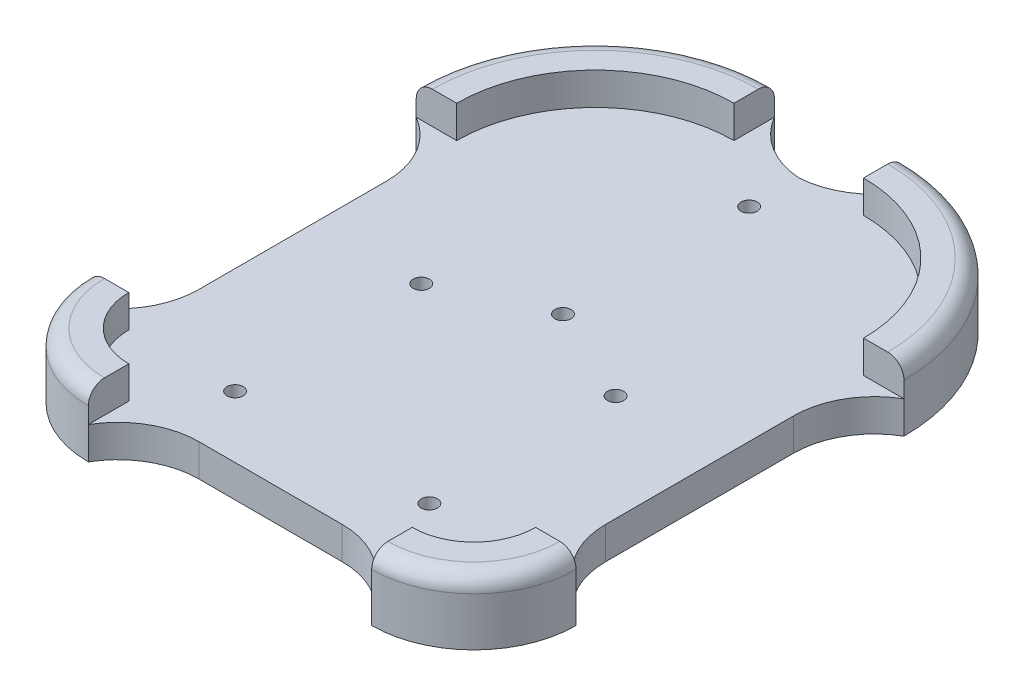
from build123d import *

# Parameters (mm, degrees)
SALIENTE_EXTRUIR1_DEPTH = 4
SALIENTE_EXTRUIR2_START = 4
SALIENTE_EXTRUIR2_DEPTH = 4
REDONDEO1_R             = 10
REDONDEO3_R             = 2
CROQUIS3_R              = 1
CROQUIS3_R_2            = 9
CORTAR_EXTRUIR1_DEPTH   = 2
CROQUIS3_3_R            = 1
CORTAR_EXTRUIR2_DEPTH   = 77.740023923


with BuildPart() as part:
    # Croquis1 → Saliente-Extruir1 (new body)
    with BuildSketch(Plane(origin=(0, 0, 0), x_dir=(1, 0, 0), z_dir=(0, 1, 0))):
        with BuildLine():
            Line((30.125, 7.5), (25.125, 7.5))
            Line((25.125, 7.5), (25.125, 48))
            Line((25.125, 48), (30.125, 48))
            ThreePointArc((30.125, 48), (23.644737534, 63.644737534), (8, 70.125))
            Line((8, 70.125), (8, 65.125))
            Line((8, 65.125), (-8, 65.125))
            Line((-8, 65.125), (-8, 70.125))
            ThreePointArc((-8, 70.125), (-23.644737534, 63.644737534), (-30.125, 48))
            Line((-30.125, 48), (-25.125, 48))
            Line((-25.125, 48), (-25.125, 7.5))
            Line((-25.125, 7.5), (-30.125, 7.5))
            ThreePointArc((-30.125, 7.5), (-26.427223112, -1.427223112), (-17.5, -5.125))
            Line((-17.5, -5.125), (-17.5, -0.125))
            Line((-17.5, -0.125), (17.5, -0.125))
            Line((17.5, -0.125), (17.5, -5.125))
            ThreePointArc((17.5, -5.125), (26.427223112, -1.427223112), (30.125, 7.5))
        make_face()
    extrude(amount=SALIENTE_EXTRUIR1_DEPTH)

    # Croquis1<3> → Saliente-Extruir2 (add)
    with BuildSketch(Plane(origin=(0, 0, 0), x_dir=(1, 0, 0), z_dir=(0, 1, 0)).offset(SALIENTE_EXTRUIR2_START)):
        with BuildLine():
            Line((-30.125, 48), (-25.125, 48))
            ThreePointArc((-25.125, 48), (-20.109203628, 60.109203628), (-8, 65.125))
            Line((-8, 65.125), (-8, 70.125))
            ThreePointArc((-8, 70.125), (-23.644737534, 63.644737534), (-30.125, 48))
        make_face()
        with BuildLine():
            Line((-17.5, -5.125), (-17.5, -0.125))
            ThreePointArc((-17.5, -0.125), (-22.891689207, 2.108310793), (-25.125, 7.5))
            Line((-25.125, 7.5), (-30.125, 7.5))
            ThreePointArc((-30.125, 7.5), (-26.427223112, -1.427223112), (-17.5, -5.125))
        make_face()
        with BuildLine():
            ThreePointArc((25.125, 7.5), (22.891689207, 2.108310793), (17.5, -0.125))
            Line((17.5, -0.125), (17.5, -5.125))
            ThreePointArc((17.5, -5.125), (26.427223112, -1.427223112), (30.125, 7.5))
            Line((30.125, 7.5), (25.125, 7.5))
        make_face()
        with BuildLine():
            ThreePointArc((8, 65.125), (20.109203628, 60.109203628), (25.125, 48))
            Line((25.125, 48), (30.125, 48))
            ThreePointArc((30.125, 48), (23.644737534, 63.644737534), (8, 70.125))
            Line((8, 70.125), (8, 65.125))
        make_face()
    extrude(amount=SALIENTE_EXTRUIR2_DEPTH)

    # Redondeo1
    # the kernel refuses this fillet: 10 mm, written as the material it adds along each edge
    with BuildSketch(Plane(origin=(8, 0, -65.125), x_dir=(-1, 0, 0), z_dir=(0, 1, 0)), Plane(origin=(-17.5, 0, 0.125), x_dir=(1, 0, 0), z_dir=(0, 1, 0)), Plane(origin=(-25.125, 0, -48), x_dir=(0, 0, 1), z_dir=(0, 1, 0))) as redondeo1_piece_1:
        with BuildLine():
            CenterArc((8.660254038, -10), REDONDEO1_R, 90, 60)
            Line((0, -5), (-0.173205081, -4.9))
            ThreePointArc((-0.173205081, -4.9), (-0.2, -2.5), (-0.2, 0))
            Line((-0.2, 0), (0, 0.2))
            Line((0, 0.2), (8.660254038, 0.2))
            Line((8.660254038, 0.2), (8.660254038, 0))
        make_face()
    extrude(amount=4)
    with BuildSketch(Plane(origin=(-8, 0, -65.125), x_dir=(0, 0, -1), z_dir=(0, 1, 0)), Plane(origin=(17.5, 0, 0.125), x_dir=(0, 0, 1), z_dir=(0, 1, 0)), Plane(origin=(25.125, 0, -48), x_dir=(1, 0, 0), z_dir=(0, 1, 0)), Plane(origin=(-25.125, 0, -7.5), x_dir=(-1, 0, 0), z_dir=(0, 1, 0))) as redondeo1_piece_2:
        with BuildLine():
            CenterArc((10, -8.660254038), REDONDEO1_R, 120, 60)
            Line((0, -8.660254038), (-0.2, -8.660254038))
            Line((-0.2, -8.660254038), (-0.2, 0))
            Line((-0.2, 0), (0, 0.2))
            ThreePointArc((0, 0.2), (2.5, 0.2), (4.9, 0.173205081))
            Line((4.9, 0.173205081), (5, 0))
        make_face()
    extrude(amount=4)
    with BuildSketch(Plane(origin=(25.125, 0, -7.5), x_dir=(1, 0, 0), z_dir=(0, 1, 0))) as redondeo1_piece_3:
        with BuildLine():
            CenterArc((10, 8.660254038), REDONDEO1_R, 180, 60)
            Line((0, 8.660254038), (-0.2, 8.660254038))
            Line((-0.2, 8.660254038), (-0.2, 0))
            Line((-0.2, 0), (0, -0.2))
            ThreePointArc((0, -0.2), (2.5, -0.2), (4.9, -0.173205081))
            Line((4.9, -0.173205081), (5, 0))
        make_face()
    extrude(amount=4)

    # Redondeo3
    redondeo3_edges = [part.edges().sort_by_distance(p)[0] for p in [
        (-23.644737534, 8, -63.644737534),
        (-26.427223112, 8, 1.427223112),
        (26.427223112, 8, 1.427223112),
        (23.644737534, 8, -63.644737534),
    ]]
    fillet(redondeo3_edges, radius=REDONDEO3_R)

    # Croquis3 → Cortar-Extruir1 (cut)
    # profile 1 of 5: a face of its own
    with BuildSketch(Plane(origin=(0, 0, 0), x_dir=(1, 0, 0), z_dir=(0, 1, 0))):
        with BuildLine():
            ThreePointArc((-9.5, 10.354191767), (-3, 19), (-9.5, 27.645808233))
            Line((-9.5, 27.645808233), (-9.5, 31.845808233))
            ThreePointArc((-9.5, 31.845808233), (-10.144365081, 33.401443152), (-11.7, 34.045808233))
            Line((-11.7, 34.045808233), (-12.3, 34.045808233))
            ThreePointArc((-12.3, 34.045808233), (-13.855634919, 33.401443152), (-14.5, 31.845808233))
            Line((-14.5, 31.845808233), (-14.5, 27.645808233))
            ThreePointArc((-14.5, 27.645808233), (-21, 19), (-14.5, 10.354191767))
            Line((-14.5, 10.354191767), (-14.5, 6.154191767))
            ThreePointArc((-14.5, 6.154191767), (-13.855634919, 4.598556848), (-12.3, 3.954191767))
            Line((-12.3, 3.954191767), (-11.7, 3.954191767))
            ThreePointArc((-11.7, 3.954191767), (-10.144365081, 4.598556848), (-9.5, 6.154191767))
            Line((-9.5, 6.154191767), (-9.5, 10.354191767))
        make_face()
        with Locations(Location((-12, 7.5, 0), (0, 0, 90))):
            Circle(CROQUIS3_R, mode=Mode.SUBTRACT)
        with Locations(Location((-12, 30.5, 0), (0, 0, 90))):
            Circle(CROQUIS3_R, mode=Mode.SUBTRACT)
    # profile 2 of 5: a face of its own
    with BuildSketch(Plane(origin=(0, 0, 0), x_dir=(1, 0, 0), z_dir=(0, 1, 0))):
        with BuildLine():
            Line((14.5, 27.645808233), (14.5, 31.845808233))
            ThreePointArc((14.5, 31.845808233), (13.855634919, 33.401443152), (12.3, 34.045808233))
            Line((12.3, 34.045808233), (11.7, 34.045808233))
            ThreePointArc((11.7, 34.045808233), (10.144365081, 33.401443152), (9.5, 31.845808233))
            Line((9.5, 31.845808233), (9.5, 27.645808233))
            ThreePointArc((9.5, 27.645808233), (3, 19), (9.5, 10.354191767))
            Line((9.5, 10.354191767), (9.5, 6.154191767))
            ThreePointArc((9.5, 6.154191767), (10.144365081, 4.598556848), (11.7, 3.954191767))
            Line((11.7, 3.954191767), (12.3, 3.954191767))
            ThreePointArc((12.3, 3.954191767), (13.855634919, 4.598556848), (14.5, 6.154191767))
            Line((14.5, 6.154191767), (14.5, 10.354191767))
            ThreePointArc((14.5, 10.354191767), (21, 19), (14.5, 27.645808233))
        make_face()
        with Locations(Location((12, 7.5, 0), (0, 0, 90))):
            Circle(CROQUIS3_R, mode=Mode.SUBTRACT)
        with Locations(Location((12, 30.5, 0), (0, 0, 90))):
            Circle(CROQUIS3_R, mode=Mode.SUBTRACT)
    # profile 3 of 5: a face of its own
    with BuildSketch(Plane(origin=(0, 0, 0), x_dir=(1, 0, 0), z_dir=(0, 1, 0))):
        with Locations((0, 47.5)):
            Circle(CROQUIS3_R_2)
    # profile 4 of 5: a face of its own
    with BuildSketch(Plane(origin=(0, 0, 0), x_dir=(1, 0, 0), z_dir=(0, 1, 0))):
        with BuildLine():
            Line((2.5, 34.654191767), (2.5, 38.854191767))
            ThreePointArc((2.5, 38.854191767), (0, 38.5), (-2.5, 38.854191767))
            Line((-2.5, 38.854191767), (-2.5, 34.654191767))
            ThreePointArc((-2.5, 34.654191767), (-1.855634919, 33.098556848), (-0.3, 32.454191767))
            Line((-0.3, 32.454191767), (0.3, 32.454191767))
            ThreePointArc((0.3, 32.454191767), (1.855634919, 33.098556848), (2.5, 34.654191767))
        make_face()
        with Locations(Location((0, 36, 0), (0, 0, 90))):
            Circle(CROQUIS3_R, mode=Mode.SUBTRACT)
    # profile 5 of 5: a face of its own
    with BuildSketch(Plane(origin=(0, 0, 0), x_dir=(1, 0, 0), z_dir=(0, 1, 0))):
        with BuildLine():
            ThreePointArc((-2.5, 56.145808233), (0, 56.5), (2.5, 56.145808233))
            Line((2.5, 56.145808233), (2.5, 60.345808233))
            ThreePointArc((2.5, 60.345808233), (1.855634919, 61.901443152), (0.3, 62.545808233))
            Line((0.3, 62.545808233), (-0.3, 62.545808233))
            ThreePointArc((-0.3, 62.545808233), (-1.855634919, 61.901443152), (-2.5, 60.345808233))
            Line((-2.5, 60.345808233), (-2.5, 56.145808233))
        make_face()
        with Locations(Location((0, 59, 0), (0, 0, 90))):
            Circle(CROQUIS3_R, mode=Mode.SUBTRACT)
    extrude(amount=CORTAR_EXTRUIR1_DEPTH, mode=Mode.SUBTRACT)

    # Croquis3<3> → Cortar-Extruir2 (cut, through all)
    with BuildSketch(Plane(origin=(0, 0, 0), x_dir=(1, 0, 0), z_dir=(0, 1, 0))):
        with Locations(Location((-12, 7.5, 0), (0, 0, 90))):
            Circle(CROQUIS3_3_R)
        with Locations(Location((-12, 30.5, 0), (0, 0, 90))):
            Circle(CROQUIS3_3_R)
        with Locations(Location((12, 7.5, 0), (0, 0, 90))):
            Circle(CROQUIS3_3_R)
        with Locations(Location((12, 30.5, 0), (0, 0, 90))):
            Circle(CROQUIS3_3_R)
        with Locations(Location((0, 59, 0), (0, 0, 90))):
            Circle(CROQUIS3_3_R)
        with Locations(Location((0, 36, 0), (0, 0, 90))):
            Circle(CROQUIS3_3_R)
    extrude(amount=CORTAR_EXTRUIR2_DEPTH, mode=Mode.SUBTRACT)


solid = part.part
